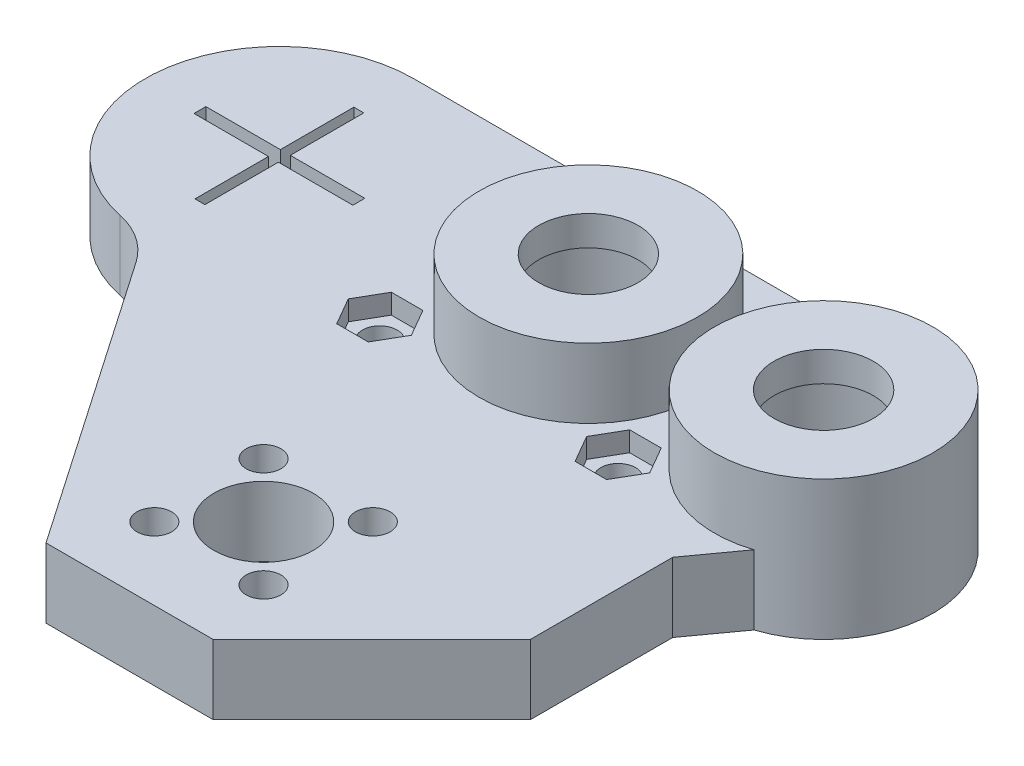
from build123d import *

# Parameters (mm, degrees)
SKETCH3_R               = 8
SKETCH3_W               = 54.803
SKETCH3_H               = 32
SKETCH3_R_2             = 5
BOSS_EXTRUDE1_DEPTH     = 7
CUT_EXTRUDE3_DEPTH      = 65.105926161
CUT_EXTRUDE3_DEPTH_BACK = 65.105926161
SKETCH4_R               = 1.75
SKETCH6_R               = 11
SKETCH6_R_2             = 8
BOSS_EXTRUDE2_DEPTH     = 4
SKETCH7_R               = 11
SKETCH7_R_2             = 5
BOSS_EXTRUDE3_DEPTH     = 3
CHAMFER1_SIZE           = 2.5
CUT_EXTRUDE5_DEPTH      = 66.242392422
CUT_EXTRUDE5_DEPTH_BACK = 66.242392422
SKETCH9_R               = 1.75
CUT_EXTRUDE6_START      = -2
SKETCH10_R              = 1.75
CUT_EXTRUDE6_DEPTH      = 2
CHAMFER3_SIZE2          = 32
CHAMFER3_SIZE           = 22
CHAMFER4_SIZE           = 16
FILLET1_DEPTH           = 7
BOSS_EXTRUDE6_START     = -5
SKETCH15_R              = 10.5
BOSS_EXTRUDE6_DEPTH     = 5


with BuildPart() as part:
    # Sketch3 → Boss-Extrude1 (new body)
    # profile 1 of 10: a face of its own
    with BuildSketch(Plane(origin=(0, 0, 0), x_dir=(1, 0, 0), z_dir=(0, 1, 0))):
        with BuildLine():
            ThreePointArc((-17.613, 0), (-21.567058454, 9.545941546), (-31.113, 13.5))
            Line((-31.113, 13.5), (-31.113, 10.5))
            ThreePointArc((-31.113, 10.5), (-23.688378798, 7.424621202), (-20.613, 0))
            ThreePointArc((-20.613, 0), (-23.688378798, -7.424621202), (-31.113, -10.5))
            Line((-31.113, -10.5), (-31.113, -13.5))
            ThreePointArc((-31.113, -13.5), (-21.567058454, -9.545941546), (-17.613, 0))
        make_face()
    # profile 2 of 10: a face of its own
    with BuildSketch(Plane(origin=(0, 0, 0), x_dir=(1, 0, 0), z_dir=(0, 1, 0))):
        with BuildLine():
            Line((-31.113, 10.5), (-31.113, 13.5))
            ThreePointArc((-31.113, 13.5), (-44.613, 0), (-31.113, -13.5))
            Line((-31.113, -13.5), (-31.113, -10.5))
            ThreePointArc((-31.113, -10.5), (-41.613, 0), (-31.113, 10.5))
        make_face()
    # profile 3 of 10: a face of its own
    with BuildSketch(Plane(origin=(0, 0, 0), x_dir=(1, 0, 0), z_dir=(0, 1, 0))):
        with BuildLine():
            Line((23.69, 13.5), (-31.113, 13.5))
            ThreePointArc((-31.113, 13.5), (-21.567058454, 9.545941546), (-17.613, 0))
            ThreePointArc((-17.613, 0), (-21.567058454, -9.545941546), (-31.113, -13.5))
            Line((-31.113, -13.5), (23.69, -13.5))
            Line((23.69, -13.5), (23.69, -11))
            ThreePointArc((23.69, -11), (12.69, 0), (23.69, 11))
            Line((23.69, 11), (23.69, 13.5))
        make_face()
        with Locations(Location((0, 0, 0), (0, 0, 270))):
            Circle(SKETCH3_R, mode=Mode.SUBTRACT)
    # profile 4 of 10: a face of its own
    with BuildSketch(Plane(origin=(0, 0, 0), x_dir=(1, 0, 0), z_dir=(0, 1, 0))):
        with BuildLine():
            ThreePointArc((-17.613, 0), (-21.567058454, 9.545941546), (-31.113, 13.5))
            Line((-31.113, 13.5), (-31.113, 10.5))
            ThreePointArc((-31.113, 10.5), (-23.688378798, 7.424621202), (-20.613, 0))
            ThreePointArc((-20.613, 0), (-23.688378798, -7.424621202), (-31.113, -10.5))
            Line((-31.113, -10.5), (-31.113, -13.5))
            ThreePointArc((-31.113, -13.5), (-21.567058454, -9.545941546), (-17.613, 0))
        make_face()
    # profile 5 of 10: a face of its own
    with BuildSketch(Plane(origin=(0, 0, 0), x_dir=(1, 0, 0), z_dir=(0, 1, 0))):
        with BuildLine():
            Line((-31.113, 10.5), (-31.113, 13.5))
            ThreePointArc((-31.113, 13.5), (-44.613, 0), (-31.113, -13.5))
            Line((-31.113, -13.5), (-31.113, -10.5))
            ThreePointArc((-31.113, -10.5), (-41.613, 0), (-31.113, 10.5))
        make_face()
    # profile 6 of 10: a face of its own
    with BuildSketch(Plane(origin=(0, 0, 0), x_dir=(1, 0, 0), z_dir=(0, 1, 0))):
        with BuildLine():
            ThreePointArc((34.69, 0), (31.468174593, 7.778174593), (23.69, 11))
            Line((23.69, 11), (23.69, 8))
            ThreePointArc((23.69, 8), (29.346854249, 5.656854249), (31.69, 0))
            ThreePointArc((31.69, 0), (29.346854249, -5.656854249), (23.69, -8))
            Line((23.69, -8), (23.69, -11))
            ThreePointArc((23.69, -11), (31.468174593, -7.778174593), (34.69, 0))
        make_face()
    # profile 7 of 10: a face of its own
    with BuildSketch(Plane(origin=(0, 0, 0), x_dir=(1, 0, 0), z_dir=(0, 1, 0))):
        with BuildLine():
            Line((23.69, 8), (23.69, 11))
            ThreePointArc((23.69, 11), (12.69, 0), (23.69, -11))
            Line((23.69, -11), (23.69, -8))
            ThreePointArc((23.69, -8), (15.69, 0), (23.69, 8))
        make_face()
    # profile 8 of 10: a face of its own
    with BuildSketch(Plane(origin=(0, 0, 0), x_dir=(1, 0, 0), z_dir=(0, 1, 0))):
        with Locations((-3.7115, -29.5)):
            Rectangle(SKETCH3_W, SKETCH3_H)
        with Locations(Location((0, -32.707574931, 0), (0, 0, 270))):
            Circle(SKETCH3_R_2, mode=Mode.SUBTRACT)
    # profile 9 of 10: a face of its own
    with BuildSketch(Plane(origin=(0, 0, 0), x_dir=(1, 0, 0), z_dir=(0, 1, 0))):
        with BuildLine():
            ThreePointArc((34.69, 0), (31.468174593, 7.778174593), (23.69, 11))
            Line((23.69, 11), (23.69, 8))
            ThreePointArc((23.69, 8), (29.346854249, 5.656854249), (31.69, 0))
            ThreePointArc((31.69, 0), (29.346854249, -5.656854249), (23.69, -8))
            Line((23.69, -8), (23.69, -11))
            ThreePointArc((23.69, -11), (31.468174593, -7.778174593), (34.69, 0))
        make_face()
    # profile 10 of 10: a face of its own
    with BuildSketch(Plane(origin=(0, 0, 0), x_dir=(1, 0, 0), z_dir=(0, 1, 0))):
        with BuildLine():
            Line((23.69, 8), (23.69, 11))
            ThreePointArc((23.69, 11), (12.69, 0), (23.69, -11))
            Line((23.69, -11), (23.69, -8))
            ThreePointArc((23.69, -8), (15.69, 0), (23.69, 8))
        make_face()
    extrude(amount=BOSS_EXTRUDE1_DEPTH)

    # Sketch4 → Cut-Extrude3 (cut, two sides: drawn at the far end of the back side and taken through both)
    with BuildSketch(Plane(origin=(0, 0, 0), x_dir=(1, 0, 0), z_dir=(0, 1, 0)).offset(-CUT_EXTRUDE3_DEPTH_BACK)):
        with Locations(Location((5.5, -27.207574931, 0), (0, 0, 270))):
            Circle(SKETCH4_R)
        with Locations(Location((5.5, -38.207574931, 0), (0, 0, 270))):
            Circle(SKETCH4_R)
        with Locations(Location((-5.5, -38.207574931, 0), (0, 0, 270))):
            Circle(SKETCH4_R)
        with Locations(Location((-5.5, -27.207574931, 0), (0, 0, 270))):
            Circle(SKETCH4_R)
    extrude(amount=CUT_EXTRUDE3_DEPTH + CUT_EXTRUDE3_DEPTH_BACK, mode=Mode.SUBTRACT)

    # Sketch6 → Boss-Extrude2 (add)
    # profile 1 of 2: a face of its own
    with BuildSketch(Plane(origin=(0, 7, 0), x_dir=(1, 0, 0), z_dir=(0, 1, 0))):
        with Locations(Location((23.69, 0, 0), (0, 0, 270))):
            Circle(SKETCH6_R)
        with Locations(Location((23.69, 0, 0), (0, 0, 270))):
            Circle(SKETCH6_R_2, mode=Mode.SUBTRACT)
    # profile 2 of 2: a face of its own
    with BuildSketch(Plane(origin=(0, 7, 0), x_dir=(1, 0, 0), z_dir=(0, 1, 0))):
        with Locations(Location((0, 0, 0), (0, 0, 270))):
            Circle(SKETCH6_R)
        with Locations(Location((0, 0, 0), (0, 0, 270))):
            Circle(SKETCH6_R_2, mode=Mode.SUBTRACT)
    extrude(amount=BOSS_EXTRUDE2_DEPTH)

    # Sketch7 → Boss-Extrude3 (add)
    # profile 1 of 2: a face of its own
    with BuildSketch(Plane(origin=(0, 11, 0), x_dir=(1, 0, 0), z_dir=(0, 1, 0))):
        with Locations(Location((23.69, 0, 0), (0, 0, 270))):
            Circle(SKETCH7_R)
        with Locations(Location((23.69, 0, 0), (0, 0, 270))):
            Circle(SKETCH7_R_2, mode=Mode.SUBTRACT)
    # profile 2 of 2: a face of its own
    with BuildSketch(Plane(origin=(0, 11, 0), x_dir=(1, 0, 0), z_dir=(0, 1, 0))):
        with Locations(Location((0, 0, 0), (0, 0, 270))):
            Circle(SKETCH7_R)
        with Locations(Location((0, 0, 0), (0, 0, 270))):
            Circle(SKETCH7_R_2, mode=Mode.SUBTRACT)
    extrude(amount=BOSS_EXTRUDE3_DEPTH)

    # Chamfer1
    # the kernel refuses this chamfer: 2.5 mm, written as the material it adds along each edge
    with BuildSketch(Plane(origin=(23.69, 0, -11), x_dir=(0.9912092295509807, 0, 0.13230367815352426), z_dir=(0, 1, 0))) as chamfer1_piece_1_section:
        with BuildLine():
            Line((2.910680919, 0), (-CHAMFER1_SIZE * 0.132303678154, CHAMFER1_SIZE * 0.991209229551))
            Line((-CHAMFER1_SIZE * 0.132303678154, CHAMFER1_SIZE * 0.991209229551), (0, 0))
            ThreePointArc((0, 0), (1.49552658, 0.096625069), (2.910680919, 0))
        make_face()
    chamfer1_piece_1 = extrude(amount=7, mode=Mode.PRIVATE)
    chamfer1_piece_1 = split(chamfer1_piece_1, bisect_by=Plane(origin=(23.69, 0, -13.5), z_dir=(0, 0, 1)), keep=Keep.TOP, mode=Mode.PRIVATE)
    add(chamfer1_piece_1)

    # Sketch9 → Cut-Extrude5 (cut, two sides: drawn at the far end of the back side and taken through both)
    with BuildSketch(Plane(origin=(0, 0, 0), x_dir=(1, 0, 0), z_dir=(0, 1, 0)).offset(-CUT_EXTRUDE5_DEPTH_BACK)):
        with Locations(Location((12, 9, 0), (0, 0, 90))):
            Circle(SKETCH9_R)
        with Locations(Location((12, -9, 0), (0, 0, 90))):
            Circle(SKETCH9_R)
        with Locations(Location((-12, -9, 0), (0, 0, 90))):
            Circle(SKETCH9_R)
        with Locations(Location((-12, 9, 0), (0, 0, 90))):
            Circle(SKETCH9_R)
    extrude(amount=CUT_EXTRUDE5_DEPTH + CUT_EXTRUDE5_DEPTH_BACK, mode=Mode.SUBTRACT)

    # Sketch10 → Cut-Extrude6 (cut)
    # profile 1 of 4: a face of its own
    with BuildSketch(Plane(origin=(0, 7, 0), x_dir=(1, 0, 0), z_dir=(0, 1, 0)).offset(CUT_EXTRUDE6_START)):
        Polygon((-15.175426481, -9), (-13.58771324, -11.75), (-10.41228676, -11.75), (-8.824573519, -9), (-10.41228676, -6.25), (-13.58771324, -6.25), align=None)
        with Locations(Location((-12, -9, 0), (0, 0, 90))):
            Circle(SKETCH10_R, mode=Mode.SUBTRACT)
    # profile 2 of 4: a face of its own
    with BuildSketch(Plane(origin=(0, 7, 0), x_dir=(1, 0, 0), z_dir=(0, 1, 0)).offset(CUT_EXTRUDE6_START)):
        Polygon((-15.175426481, 9), (-13.58771324, 6.25), (-10.41228676, 6.25), (-8.824573519, 9), (-10.41228676, 11.75), (-13.58771324, 11.75), align=None)
        with Locations(Location((-12, 9, 0), (0, 0, 90))):
            Circle(SKETCH10_R, mode=Mode.SUBTRACT)
    # profile 3 of 4: a face of its own
    with BuildSketch(Plane(origin=(0, 7, 0), x_dir=(1, 0, 0), z_dir=(0, 1, 0)).offset(CUT_EXTRUDE6_START)):
        Polygon((15.175426481, 9), (13.58771324, 11.75), (10.41228676, 11.75), (8.824573519, 9), (10.41228676, 6.25), (13.58771324, 6.25), align=None)
        with Locations(Location((12, 9, 0), (0, 0, 90))):
            Circle(SKETCH10_R, mode=Mode.SUBTRACT)
    # profile 4 of 4: a face of its own
    with BuildSketch(Plane(origin=(0, 7, 0), x_dir=(1, 0, 0), z_dir=(0, 1, 0)).offset(CUT_EXTRUDE6_START)):
        Polygon((15.175426481, -9), (13.58771324, -6.25), (10.41228676, -6.25), (8.824573519, -9), (10.41228676, -11.75), (13.58771324, -11.75), align=None)
        with Locations(Location((12, -9, 0), (0, 0, 90))):
            Circle(SKETCH10_R, mode=Mode.SUBTRACT)
    extrude(amount=CUT_EXTRUDE6_DEPTH, mode=Mode.SUBTRACT)

    # Chamfer2
    # the kernel refuses this chamfer: 5 mm, written as the material it adds along each edge
    with BuildSketch(Plane(origin=(23.69, 0, 11), x_dir=(0.9874000606639179, 0, -0.15824386307497393), z_dir=(0, 1, 0))) as chamfer2_piece_1:
        with BuildLine():
            Line((3.622786344, 0.141421356), (-0.805837357, -4.287202344))
            Line((-0.805837357, -4.287202344), (-0.904577363, -4.271377958))
            ThreePointArc((-0.904577363, -4.271377958), (-0.443767224, -2.137054655), (-0.098740006, 0.015824386))
            Line((-0.098740006, 0.015824386), (0.015824386, 0.098740006))
            ThreePointArc((0.015824386, 0.098740006), (1.81210794, -0.038365312), (3.606961958, 0.240161362))
            Line((3.606961958, 0.240161362), (3.622786344, 0.141421356))
        make_face()
    extrude(amount=7)

    # Chamfer3
    chamfer3_edges = [part.edges().sort_by_distance(p)[0] for p in [
        (-31.113, 3.5, 45.5),
    ]]
    chamfer3_side = [part.faces().sort_by_distance(p)[0] for p in [
        (-30.673, 3.5, 45.5),
    ]]
    chamfer(chamfer3_edges, length=CHAMFER3_SIZE - 0.0001, length2=CHAMFER3_SIZE2 - 0.0001, reference=chamfer3_side[0])  # a hair under: the kernel refuses the full size

    # Chamfer4
    chamfer4_edges = [part.edges().sort_by_distance(p)[0] for p in [
        (23.69, 3.5, 45.5),
    ]]
    chamfer(chamfer4_edges, length=CHAMFER4_SIZE)

    # Fillet1: read off the stored shape, not the designer's step
    # Fillet1 outline → Fillet1 (add)
    with BuildSketch(Plane(origin=(0, 0, 0), x_dir=(1, 0, 0), z_dir=(0, 1, 0))):
        with BuildLine():
            ThreePointArc((-31.113, -13.5), (-32.547033058, -13.423619079), (-33.96483904, -13.19534062))
            ThreePointArc((-33.96483904, -13.19534062), (-31.199410591, -14.370304214), (-29.062482337, -16.482571146))
            Line((-29.062482337, -16.482571146), (-31.113, -13.5))
        make_face()
    extrude(amount=FILLET1_DEPTH)

    # Sketch15 → Boss-Extrude6 (add)
    with BuildSketch(Plane(origin=(0, 7, 0), x_dir=(1, 0, 0), z_dir=(0, 1, 0)).offset(BOSS_EXTRUDE6_START)):
        with Locations(Location((-31.113, 0, 0), (0, 0, 270))):
            Circle(SKETCH15_R)
        Polygon((-31.613, 0.6), (-31.613, 8), (-30.613, 8), (-30.613, 0.6), (-23.113, 0.6), (-23.113, -0.6), (-30.613, -0.6), (-30.613, -8), (-31.613, -8), (-31.613, -0.6), (-39.113, -0.6), (-39.113, 0.6), align=None, mode=Mode.SUBTRACT)
    extrude(amount=BOSS_EXTRUDE6_DEPTH)


solid = part.part
